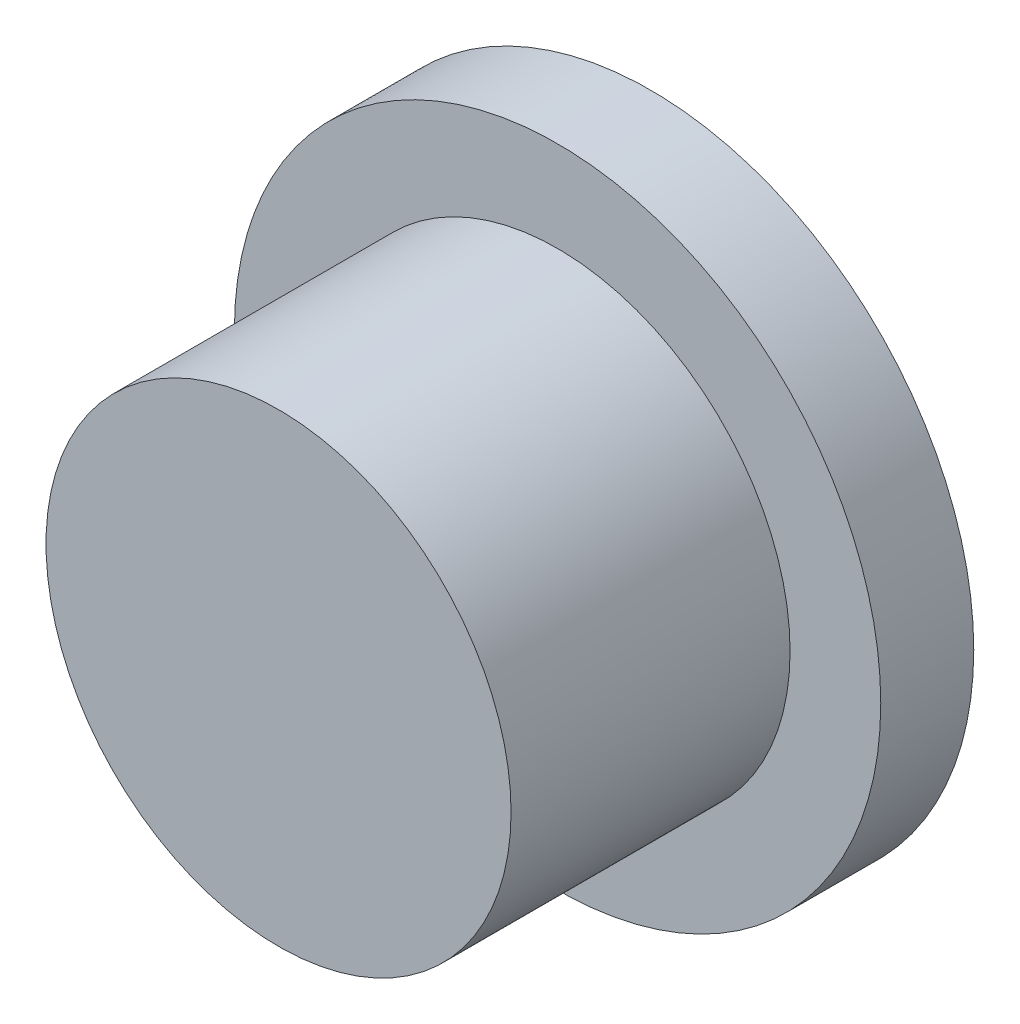
from build123d import *

# Parameters (mm, degrees)
IZIM1_R                     = 6.95
Y_KSEKLIK_EKSTR_ZYON1_DEPTH = 2
IZIM2_R                     = 5
Y_KSEKLIK_EKSTR_ZYON2_DEPTH = 6


with BuildPart() as part:
    # Çizim1 → Yükseklik-Ekstrüzyon1 (new body)
    with BuildSketch(Plane.XY):
        Circle(IZIM1_R)
    extrude(amount=Y_KSEKLIK_EKSTR_ZYON1_DEPTH)

    # Çizim2 → Yükseklik-Ekstrüzyon2 (add)
    with BuildSketch(Plane.XY.offset(2)):
        Circle(IZIM2_R)
    extrude(amount=Y_KSEKLIK_EKSTR_ZYON2_DEPTH)


solid = part.part
